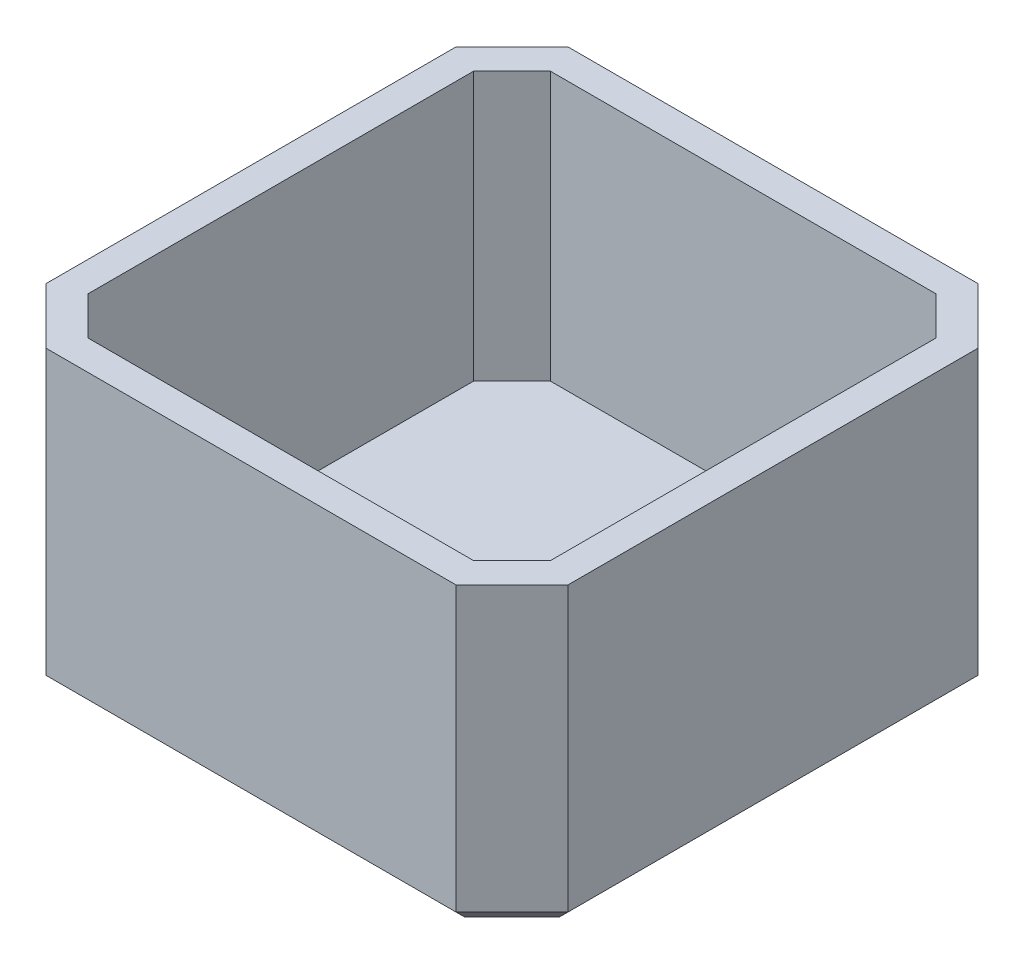
from build123d import *

# Parameters (mm, degrees)
SALIENTE_EXTRUIR2_DEPTH = 40
VACIADO2_T              = -4
CHAFL_N2_SIZE           = 2


with BuildPart() as part:
    # Croquis1 → Saliente-Extruir2 (new body)
    with BuildSketch(Plane(origin=(0, 0, 0), x_dir=(1, 0, 0), z_dir=(0, 1, 0))):
        Polygon((35, -27.5), (35, 27.5), (27.5, 35), (-27.5, 35), (-35, 27.5), (-35, -27.5), (-27.5, -35), (27.5, -35), align=None)
    extrude(amount=SALIENTE_EXTRUIR2_DEPTH)

    # Vaciado2
    vaciado2_openings = [part.faces().sort_by_distance(p)[0] for p in [
        (0, 40, 0),
    ]]
    offset(amount=VACIADO2_T, openings=vaciado2_openings, kind=Kind.INTERSECTION)

    # Chaflán2
    chafl_n2_edges = [part.edges().sort_by_distance(p)[0] for p in [
        (-35, 0, 0),
        (-31.25, 0, -31.25),
        (0, 0, -35),
        (31.25, 0, -31.25),
        (35, 0, 0),
        (31.25, 0, 31.25),
        (0, 0, 35),
        (-31.25, 0, 31.25),
    ]]
    chamfer(chafl_n2_edges, length=CHAFL_N2_SIZE)


solid = part.part
